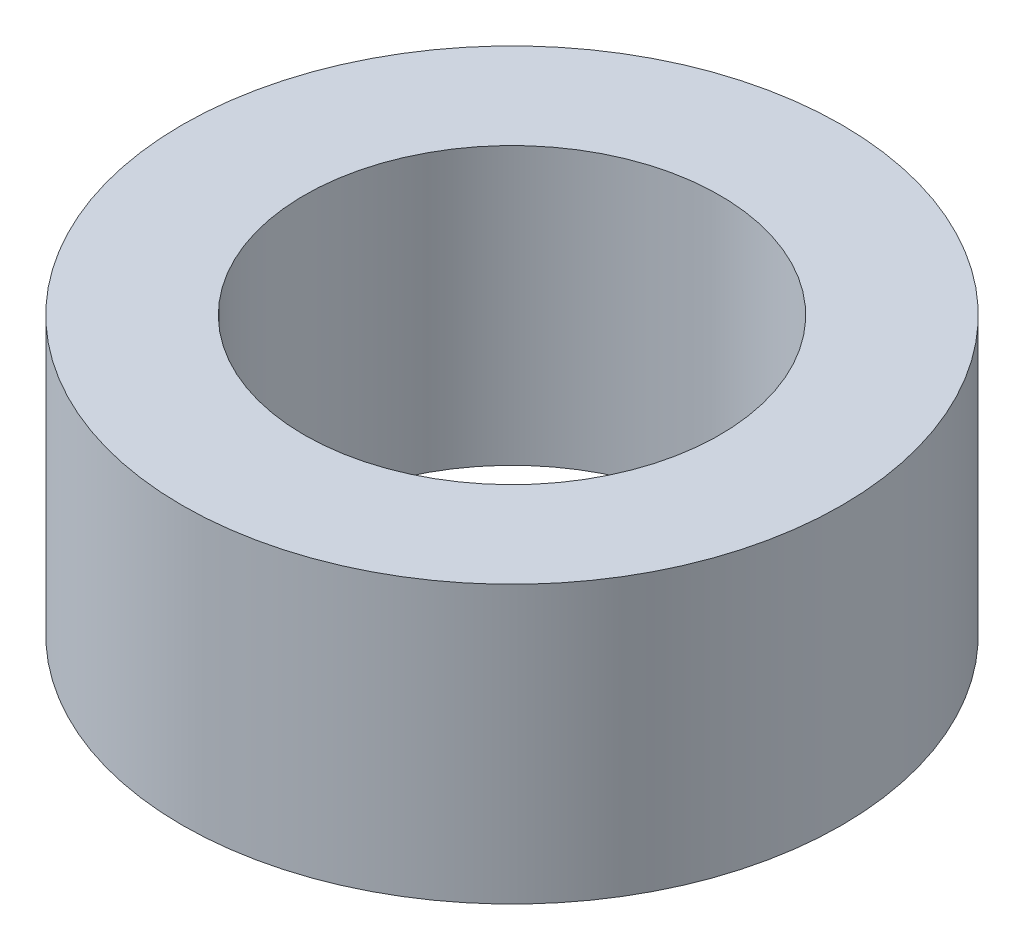
from build123d import *

# Parameters (mm, degrees)
SKETCH1_R           = 6.35
BOSS_EXTRUDE1_DEPTH = 5.334
SKETCH3_R           = 4
CUT_EXTRUDE2_DEPTH  = 11.444929679


with BuildPart() as part:
    # Sketch1 → Boss-Extrude1 (new body)
    with BuildSketch(Plane(origin=(0, 0, 0), x_dir=(1, 0, 0), z_dir=(0, 1, 0))):
        Circle(SKETCH1_R)
    extrude(amount=BOSS_EXTRUDE1_DEPTH)

    # Sketch3 → Cut-Extrude2 (cut, through all)
    with BuildSketch(Plane(origin=(0, 5.334, 0), x_dir=(1, 0, 0), z_dir=(0, 1, 0))):
        Circle(SKETCH3_R)
    extrude(amount=-CUT_EXTRUDE2_DEPTH, mode=Mode.SUBTRACT)


solid = part.part
